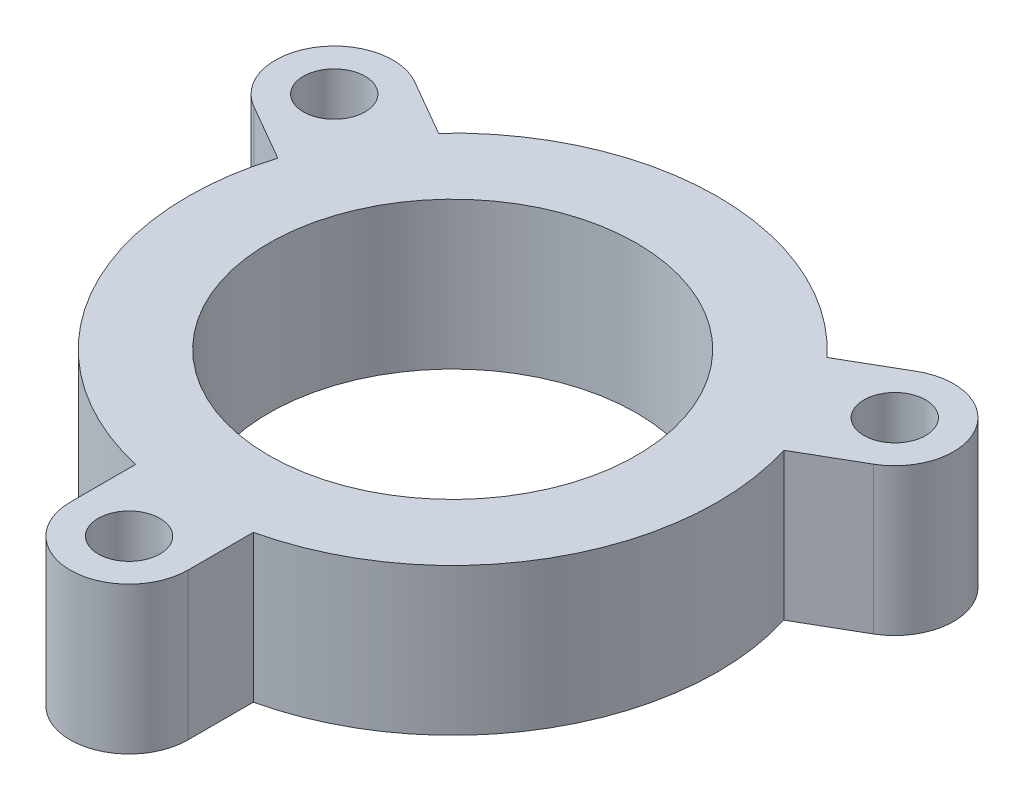
from build123d import *

# Parameters (mm, degrees)
SKETCH1_R           = 2.1
SKETCH1_R_2         = 12.5
BOSS_EXTRUDE1_DEPTH = 10


with BuildPart() as part:
    # Sketch1 → Boss-Extrude1 (new body)
    with BuildSketch(Plane(origin=(0, 0, 0), x_dir=(1, 0, 0), z_dir=(0, 1, 0))):
        with BuildLine():
            Line((4, -22), (4, -17.549928775))
            ThreePointArc((4, -17.549928775), (15.588457268, -9), (17.198684154, 5.310862772))
            Line((17.198684154, 5.310862772), (21.052558883, 7.535898385))
            ThreePointArc((21.052558883, 7.535898385), (22.516660498, 13), (17.052558883, 14.464101615))
            Line((17.052558883, 14.464101615), (13.198684154, 12.239066003))
            ThreePointArc((13.198684154, 12.239066003), (0, 18), (-13.198684154, 12.239066003))
            Line((-13.198684154, 12.239066003), (-17.052558883, 14.464101615))
            ThreePointArc((-17.052558883, 14.464101615), (-22.516660498, 13), (-21.052558883, 7.535898385))
            Line((-21.052558883, 7.535898385), (-17.198684154, 5.310862772))
            ThreePointArc((-17.198684154, 5.310862772), (-15.588457268, -9), (-4, -17.549928775))
            Line((-4, -17.549928775), (-4, -22))
            ThreePointArc((-4, -22), (0, -26), (4, -22))
        make_face()
        with Locations((0, -22)):
            Circle(SKETCH1_R, mode=Mode.SUBTRACT)
        Circle(SKETCH1_R_2, mode=Mode.SUBTRACT)
        with Locations((-19.052558883, 11)):
            Circle(SKETCH1_R, mode=Mode.SUBTRACT)
        with Locations((19.052558883, 11)):
            Circle(SKETCH1_R, mode=Mode.SUBTRACT)
    extrude(amount=BOSS_EXTRUDE1_DEPTH)


solid = part.part
